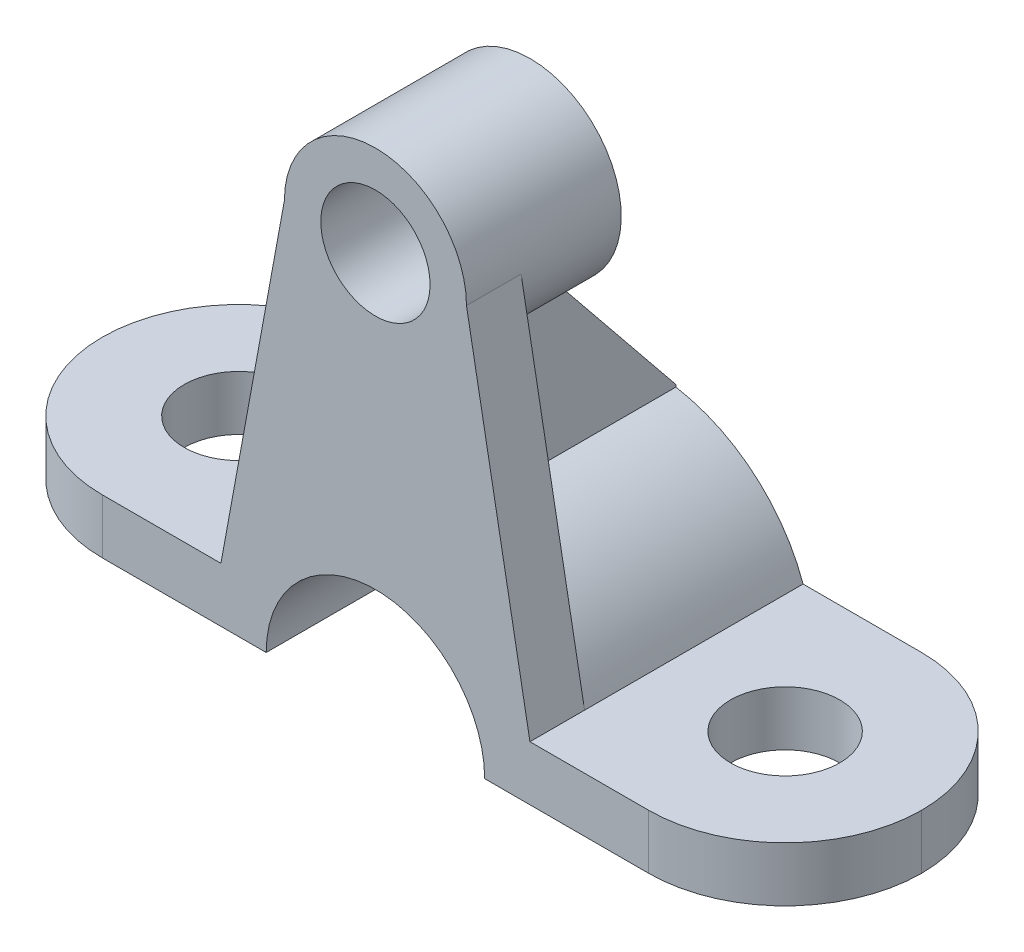
from build123d import *

# Parameters (mm, degrees)
BOSS_EXTRUDE1_DEPTH = 30
FILLET1_R           = 30
FILLET2_R           = 30
SKETCH5_R           = 12
CUT_EXTRUDE1_DEPTH  = 98.857038582
FILLET3_RADIUS      = 30
FILLET3_LENGTH      = 12
SKETCH6_R           = 12
CUT_EXTRUDE2_DEPTH  = 98.857038582
SKETCH2_R           = 20
SKETCH2_R_2         = 12
BOSS_EXTRUDE2_DEPTH = 34
BOSS_EXTRUDE3_DEPTH = 12
BOSS_EXTRUDE4_DEPTH = 6


with BuildPart() as part:
    # Sketch1 → Boss-Extrude1 (new, symmetric)
    with BuildSketch(Plane.XY):
        with BuildLine():
            Line((-90, 0), (-24, 0))
            ThreePointArc((-24, 0), (0, 24), (24, 0))
            Line((24, 0), (90, 0))
            Line((90, 0), (90, 12))
            Line((90, 12), (33.941125497, 12))
            ThreePointArc((33.941125497, 12), (0, 36), (-33.941125497, 12))
            Line((-33.941125497, 12), (-90, 12))
            Line((-90, 12), (-90, 0))
        make_face()
    extrude(amount=BOSS_EXTRUDE1_DEPTH, both=True)

    # Fillet1
    fillet1_edges = [part.edges().sort_by_distance(p)[0] for p in [
        (90, 6, -30),
    ]]
    fillet(fillet1_edges, radius=FILLET1_R)

    # Fillet2
    fillet2_edges = [part.edges().sort_by_distance(p)[0] for p in [
        (90, 6, 30),
    ]]
    fillet(fillet2_edges, radius=FILLET2_R - 0.0001)  # a hair under: the kernel refuses the full size

    # Sketch5 → Cut-Extrude1 (cut, through all)
    with BuildSketch(Plane(origin=(0, 12, 0), x_dir=(1, 0, 0), z_dir=(0, 1, 0))):
        with Locations(Location((60, 0, 0), (0, 0, 180))):
            Circle(SKETCH5_R)
    extrude(amount=-CUT_EXTRUDE1_DEPTH, mode=Mode.SUBTRACT)

    # Fillet3: full round fillet: the end face becomes a half cylinder, R = half its width
    fillet3_face = Plane((-90, 6, 0), x_dir=(0, -1, 0), z_dir=(-1, 0, 0))  # on the end face: x along it, z out of the body
    fillet3_slab = fillet3_face.offset(-FILLET3_RADIUS / 2) * Box(FILLET3_LENGTH, 2 * FILLET3_RADIUS, FILLET3_RADIUS, mode=Mode.PRIVATE)  # the body's end, R deep
    fillet3_round = Plane((-60, 6, 0), x_dir=(-1, 0, 0), z_dir=(0, -1, 0)) * Cylinder(FILLET3_RADIUS, FILLET3_LENGTH, mode=Mode.PRIVATE)  # its axis R under the face
    add(fillet3_slab - fillet3_round, mode=Mode.SUBTRACT)

    # Sketch6 → Cut-Extrude2 (cut, through all)
    with BuildSketch(Plane(origin=(0, 12, 0), x_dir=(1, 0, 0), z_dir=(0, 1, 0))):
        with Locations(Location((-60, 0, 0), (0, 0, 180))):
            Circle(SKETCH6_R)
    extrude(amount=-CUT_EXTRUDE2_DEPTH, mode=Mode.SUBTRACT)



with BuildPart() as body_2:
    # Sketch2 → Boss-Extrude2 (new body)
    with BuildSketch(Plane.XY.offset(30)):
        with Locations((0, 88)):
            Circle(SKETCH2_R)
        with Locations((0, 88)):
            Circle(SKETCH2_R_2, mode=Mode.SUBTRACT)
    extrude(amount=-BOSS_EXTRUDE2_DEPTH)


with BuildPart() as part_1:
    add(part.part)

    add(body_2.part)  # Boss-Extrude3 merges body 2
    # Sketch3 → Boss-Extrude3 (add)
    with BuildSketch(Plane.XY.offset(30)):
        with BuildLine():
            Line((33.941125497, 12), (20, 88))
            ThreePointArc((20, 88), (0, 68), (-20, 88))
            Line((-20, 88), (-33.941125497, 12))
            ThreePointArc((-33.941125497, 12), (0, 36), (33.941125497, 12))
        make_face()
    extrude(amount=-BOSS_EXTRUDE3_DEPTH)

    # Sketch4 → Boss-Extrude4 (add, symmetric)
    with BuildSketch(Plane(origin=(0, 0, 0), x_dir=(0, 0, -1), z_dir=(1, 0, 0))):
        Polygon((-16.617348449, 30.307571786), (-22.191110534, 30.307571786), (-22.191110534, 71.304305049), (4, 71.304305049), (4, 68.110118748), (30, 36), (30, 30.307571786), align=None)
    extrude(amount=BOSS_EXTRUDE4_DEPTH, both=True)


solid = part_1.part
